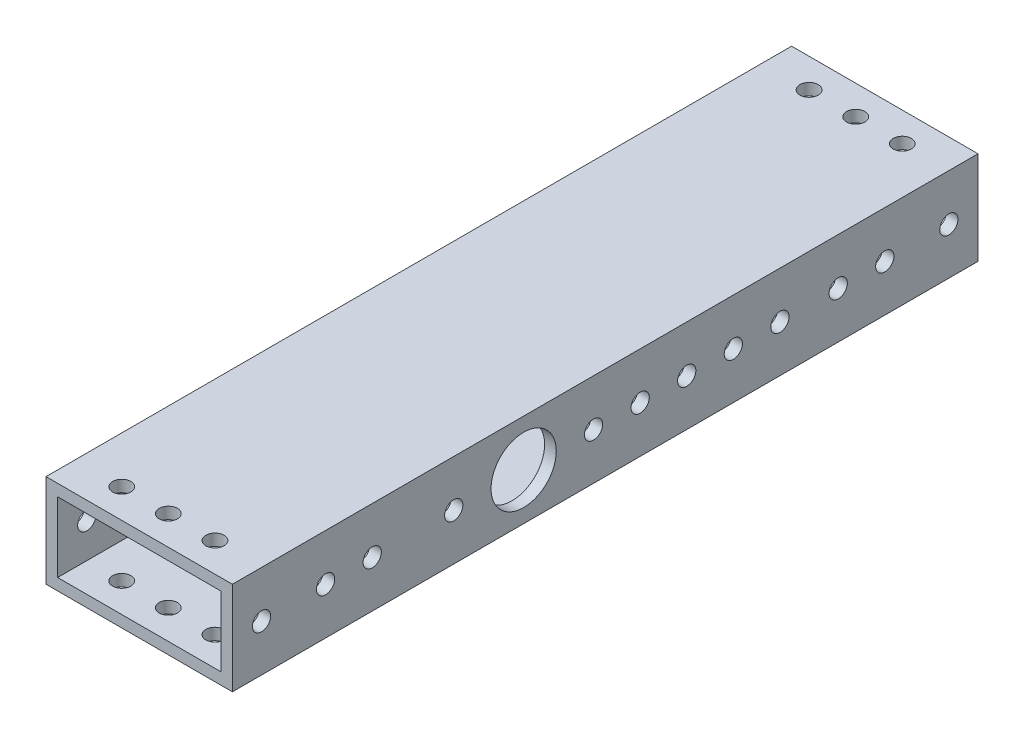
from build123d import *

# Parameters (mm, degrees)
SKETCH1_W           = 50.8
SKETCH1_H           = 25.4
SKETCH1_W_2         = 44.45
SKETCH1_H_2         = 19.05
BOSS_EXTRUDE1_DEPTH = 101.6
SKETCH3_R           = 2.4892
CUT_EXTRUDE2_DEPTH  = 108.763073453
SKETCH4_R           = 8.89
SKETCH4_R_2         = 2.4892
CUT_EXTRUDE3_DEPTH  = 115.3
SKETCH2_R           = 2.4892
CUT_EXTRUDE1_DEPTH  = 115.3
CUT_EXTRUDE4_REACH  = 109.763
SKETCH5_R           = 2.4892
CUT_EXTRUDE5_REACH  = 116.3
SKETCH7_R           = 2.4892


with BuildPart() as part:
    # Sketch1 → Boss-Extrude1 (new, symmetric)
    with BuildSketch(Plane.XY):
        Rectangle(SKETCH1_W, SKETCH1_H)
        Rectangle(SKETCH1_W_2, SKETCH1_H_2, mode=Mode.SUBTRACT)
    extrude(amount=BOSS_EXTRUDE1_DEPTH, both=True)

    # Sketch3 → Cut-Extrude2 (cut, through all)
    with BuildSketch(Plane(origin=(0, 12.7, 0), x_dir=(1, 0, 0), z_dir=(0, 1, 0))):
        with Locations((-12.7, -93.6625)):
            Circle(SKETCH3_R)
        with Locations((0, -93.6625)):
            Circle(SKETCH3_R)
        with Locations((12.7, -93.6625)):
            Circle(SKETCH3_R)
        with Locations((12.7, 93.6625)):
            Circle(SKETCH3_R)
        with Locations((0, 93.6625)):
            Circle(SKETCH3_R)
        with Locations((-12.7, 93.6625)):
            Circle(SKETCH3_R)
    extrude(amount=-CUT_EXTRUDE2_DEPTH, mode=Mode.SUBTRACT)

    # Sketch4 → Cut-Extrude3 (cut, through all)
    with BuildSketch(Plane(origin=(25.4, 0, 0), x_dir=(0, 0, -1), z_dir=(1, 0, 0))):
        with Locations((-22.225, 0)):
            Circle(SKETCH4_R)
        with Locations((34.925, 0)):
            Circle(SKETCH4_R_2)
        with Locations((22.225, 0)):
            Circle(SKETCH4_R_2)
    extrude(amount=-CUT_EXTRUDE3_DEPTH, mode=Mode.SUBTRACT)

    # Sketch2 → Cut-Extrude1 (cut, through all)
    with BuildSketch(Plane(origin=(25.4, 0, 0), x_dir=(0, 0, -1), z_dir=(1, 0, 0))):
        with Locations((-93.6625, 0)):
            Circle(SKETCH2_R)
        with Locations((93.6625, 0)):
            Circle(SKETCH2_R)
        with Locations((-76.2, 0)):
            Circle(SKETCH2_R)
        with Locations((-63.5, 0)):
            Circle(SKETCH2_R)
        with Locations((63.5, 0)):
            Circle(SKETCH2_R)
        with Locations((76.2, 0)):
            Circle(SKETCH2_R)
    extrude(amount=-CUT_EXTRUDE1_DEPTH, mode=Mode.SUBTRACT)

    # Sketch5 → Cut-Extrude4 (cut, up to next)
    with BuildSketch(Plane.XZ.offset(12.7), mode=Mode.PRIVATE) as cut_extrude4_sk1:
        with Locations((-3.175, 66.675)):
            Circle(SKETCH5_R)
    cut_extrude4_tool1 = extrude(cut_extrude4_sk1.sketch, amount=-CUT_EXTRUDE4_REACH, mode=Mode.PRIVATE) & part.part
    # Sketch5 → Cut-Extrude4 (cut, up to next)
    with BuildSketch(Plane.XZ.offset(12.7), mode=Mode.PRIVATE) as cut_extrude4_sk2:
        with Locations((-15.875, 66.675)):
            Circle(SKETCH5_R)
    cut_extrude4_tool2 = extrude(cut_extrude4_sk2.sketch, amount=-CUT_EXTRUDE4_REACH, mode=Mode.PRIVATE) & part.part
    # Sketch5 → Cut-Extrude4 (cut, up to next)
    with BuildSketch(Plane.XZ.offset(12.7), mode=Mode.PRIVATE) as cut_extrude4_sk3:
        with Locations((-15.875, 53.975)):
            Circle(SKETCH5_R)
    cut_extrude4_tool3 = extrude(cut_extrude4_sk3.sketch, amount=-CUT_EXTRUDE4_REACH, mode=Mode.PRIVATE) & part.part
    # Sketch5 → Cut-Extrude4 (cut, up to next)
    with BuildSketch(Plane.XZ.offset(12.7), mode=Mode.PRIVATE) as cut_extrude4_sk4:
        with Locations((-3.175, 53.975)):
            Circle(SKETCH5_R)
    cut_extrude4_tool4 = extrude(cut_extrude4_sk4.sketch, amount=-CUT_EXTRUDE4_REACH, mode=Mode.PRIVATE) & part.part
    # Sketch5 → Cut-Extrude4 (cut, up to next)
    with BuildSketch(Plane.XZ.offset(12.7), mode=Mode.PRIVATE) as cut_extrude4_sk5:
        with Locations((-3.175, -9.525)):
            Circle(SKETCH5_R)
    cut_extrude4_tool5 = extrude(cut_extrude4_sk5.sketch, amount=-CUT_EXTRUDE4_REACH, mode=Mode.PRIVATE) & part.part
    # Sketch5 → Cut-Extrude4 (cut, up to next)
    with BuildSketch(Plane.XZ.offset(12.7), mode=Mode.PRIVATE) as cut_extrude4_sk6:
        with Locations((-15.875, -9.525)):
            Circle(SKETCH5_R)
    cut_extrude4_tool6 = extrude(cut_extrude4_sk6.sketch, amount=-CUT_EXTRUDE4_REACH, mode=Mode.PRIVATE) & part.part
    # Sketch5 → Cut-Extrude4 (cut, up to next)
    with BuildSketch(Plane.XZ.offset(12.7), mode=Mode.PRIVATE) as cut_extrude4_sk7:
        with Locations((-15.875, -22.225)):
            Circle(SKETCH5_R)
    cut_extrude4_tool7 = extrude(cut_extrude4_sk7.sketch, amount=-CUT_EXTRUDE4_REACH, mode=Mode.PRIVATE) & part.part
    # Sketch5 → Cut-Extrude4 (cut, up to next)
    with BuildSketch(Plane.XZ.offset(12.7), mode=Mode.PRIVATE) as cut_extrude4_sk8:
        with Locations((-3.175, -22.225)):
            Circle(SKETCH5_R)
    cut_extrude4_tool8 = extrude(cut_extrude4_sk8.sketch, amount=-CUT_EXTRUDE4_REACH, mode=Mode.PRIVATE) & part.part
    add(cut_extrude4_tool1.solids().sort_by_distance((-3.175, -12.7, 66.675))[0], mode=Mode.SUBTRACT)
    add(cut_extrude4_tool2.solids().sort_by_distance((-15.875, -12.7, 66.675))[0], mode=Mode.SUBTRACT)
    add(cut_extrude4_tool3.solids().sort_by_distance((-15.875, -12.7, 53.975))[0], mode=Mode.SUBTRACT)
    add(cut_extrude4_tool4.solids().sort_by_distance((-3.175, -12.7, 53.975))[0], mode=Mode.SUBTRACT)
    add(cut_extrude4_tool5.solids().sort_by_distance((-3.175, -12.7, -9.525))[0], mode=Mode.SUBTRACT)
    add(cut_extrude4_tool6.solids().sort_by_distance((-15.875, -12.7, -9.525))[0], mode=Mode.SUBTRACT)
    add(cut_extrude4_tool7.solids().sort_by_distance((-15.875, -12.7, -22.225))[0], mode=Mode.SUBTRACT)
    add(cut_extrude4_tool8.solids().sort_by_distance((-3.175, -12.7, -22.225))[0], mode=Mode.SUBTRACT)

    # Sketch7 → Cut-Extrude5 (cut, up to next)
    with BuildSketch(Plane(origin=(25.4, 0, 0), x_dir=(0, 0, -1), z_dir=(1, 0, 0)), mode=Mode.PRIVATE) as cut_extrude5_sk1:
        with Locations((47.625, 0)):
            Circle(SKETCH7_R)
    cut_extrude5_tool1 = extrude(cut_extrude5_sk1.sketch, amount=-CUT_EXTRUDE5_REACH, mode=Mode.PRIVATE) & part.part
    # Sketch7 → Cut-Extrude5 (cut, up to next)
    with BuildSketch(Plane(origin=(25.4, 0, 0), x_dir=(0, 0, -1), z_dir=(1, 0, 0)), mode=Mode.PRIVATE) as cut_extrude5_sk2:
        with Locations((9.525, 0)):
            Circle(SKETCH7_R)
    cut_extrude5_tool2 = extrude(cut_extrude5_sk2.sketch, amount=-CUT_EXTRUDE5_REACH, mode=Mode.PRIVATE) & part.part
    # Sketch7 → Cut-Extrude5 (cut, up to next)
    with BuildSketch(Plane(origin=(25.4, 0, 0), x_dir=(0, 0, -1), z_dir=(1, 0, 0)), mode=Mode.PRIVATE) as cut_extrude5_sk3:
        with Locations((-3.175, 0)):
            Circle(SKETCH7_R)
    cut_extrude5_tool3 = extrude(cut_extrude5_sk3.sketch, amount=-CUT_EXTRUDE5_REACH, mode=Mode.PRIVATE) & part.part
    # Sketch7 → Cut-Extrude5 (cut, up to next)
    with BuildSketch(Plane(origin=(25.4, 0, 0), x_dir=(0, 0, -1), z_dir=(1, 0, 0)), mode=Mode.PRIVATE) as cut_extrude5_sk4:
        with Locations((-41.275, 0)):
            Circle(SKETCH7_R)
    cut_extrude5_tool4 = extrude(cut_extrude5_sk4.sketch, amount=-CUT_EXTRUDE5_REACH, mode=Mode.PRIVATE) & part.part
    add(cut_extrude5_tool1.solids().sort_by_distance((25.4, 0, -47.625))[0], mode=Mode.SUBTRACT)
    add(cut_extrude5_tool2.solids().sort_by_distance((25.4, 0, -9.525))[0], mode=Mode.SUBTRACT)
    add(cut_extrude5_tool3.solids().sort_by_distance((25.4, 0, 3.175))[0], mode=Mode.SUBTRACT)
    add(cut_extrude5_tool4.solids().sort_by_distance((25.4, 0, 41.275))[0], mode=Mode.SUBTRACT)


solid = part.part
